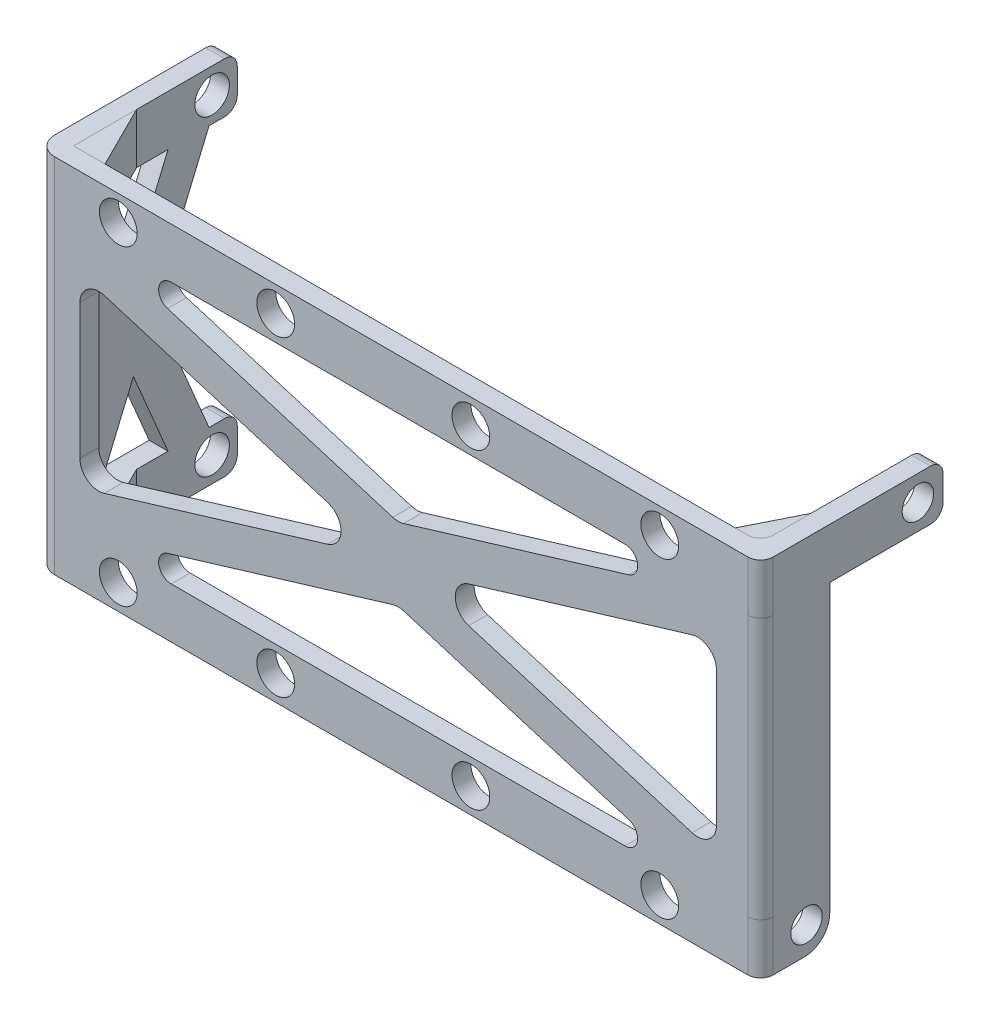
from build123d import *

# Parameters (mm, degrees)
SKETCH1_R             = 2.75
BOSS_EXTRUDE1_DEPTH   = 3
BOSS_EXTRUDE1_2_DEPTH = 3
SKETCH2_W             = 3
SKETCH2_H             = 8
BOSS_EXTRUDE3_DEPTH   = 112.1
SKETCH2_3_W           = 3
SKETCH2_3_H           = 8
BOSS_EXTRUDE4_DEPTH   = 112.1
SKETCH3_W             = 3
SKETCH3_H             = 8
BOSS_EXTRUDE5_DEPTH   = 26
SKETCH3_3_W           = 3
SKETCH3_3_H           = 8
BOSS_EXTRUDE6_DEPTH   = 8
FILLET1_R             = 2
FILLET2_R             = 2
FILLET4_R             = 2
SKETCH6_R             = 2.5
CUT_EXTRUDE1_DEPTH    = 3
SKETCH5_R             = 2.5
CUT_EXTRUDE2_DEPTH    = 3
BOSS_EXTRUDE7_DEPTH   = 3
FILLET6_R             = 4
FILLET7_R             = 3
FILLET8_START         = -30
FILLET8_DEPTH         = 60
GUSSET5_THICKNESS     = 8
GUSSET6_THICKNESS     = 8
FILLET14_R            = 2
BOSS_EXTRUDE15_REACH  = 129.762
SKETCH20_W            = 3
SKETCH20_H            = 8
GUSSET7_THICKNESS     = 10
FILLET15_R            = 2
FILLET16_R            = 2
FILLET18_R            = 2
GUSSET8_START         = -20
GUSSET8_DEPTH         = 10
FILLET19_R            = 2
SKETCH10_R            = 3
CUT_EXTRUDE3_DEPTH    = 3
BOSS_EXTRUDE16_DEPTH  = 3


with BuildPart() as part:
    # Sketch1 → Boss-Extrude1 (new body)
    with BuildSketch(Plane(origin=(0, 0, 0), x_dir=(0, 0, -1), z_dir=(1, 0, 0))):
        with BuildLine():
            Line((-25, 28.748737342), (2, 28.748737342))
            ThreePointArc((2, 28.748737342), (3.414213562, 28.162950904), (4, 26.748737342))
            Line((4, 26.748737342), (4, 22.748737342))
            ThreePointArc((4, 22.748737342), (3.414213562, 21.334523779), (2, 20.748737342))
            Line((2, 20.748737342), (-25, 20.748737342))
            Line((-25, 20.748737342), (-25, 28.748737342))
        make_face()
        with Locations((0, 24.748737342)):
            Circle(SKETCH1_R, mode=Mode.SUBTRACT)
    extrude(amount=BOSS_EXTRUDE1_DEPTH)

    # Sketch2 → Boss-Extrude3 (add)
    with BuildSketch(Plane(origin=(3, 0, 0), x_dir=(0, 0, -1), z_dir=(1, 0, 0))):
        with Locations((-23.5, 24.748737342)):
            Rectangle(SKETCH2_W, SKETCH2_H)
    extrude(amount=BOSS_EXTRUDE3_DEPTH)

    # Sketch3 → Boss-Extrude5 (add)
    with BuildSketch(Plane(origin=(0, 0, 22), x_dir=(-1, 0, 0), z_dir=(0, 0, -1))):
        with Locations((-113.6, 24.748737342)):
            Rectangle(SKETCH3_W, SKETCH3_H)
    extrude(amount=BOSS_EXTRUDE5_DEPTH)

    # Fillet1
    fillet1_edges = [part.edges().sort_by_distance(p)[0] for p in [
        (115.1, 24.748737342, 25),
        (0, 24.748737342, 25),
    ]]
    fillet(fillet1_edges, radius=FILLET1_R)

    # Fillet4
    fillet4_edges = [part.edges().sort_by_distance(p)[0] for p in [
        (113.6, 28.748737342, -4),
        (113.6, 20.748737342, -4),
    ]]
    fillet(fillet4_edges, radius=FILLET4_R)

    # Sketch5 → Cut-Extrude2 (cut)
    with BuildSketch(Plane(origin=(115.1, 0, 0), x_dir=(0, 0, -1), z_dir=(1, 0, 0))):
        with Locations((0, 24.748737342)):
            Circle(SKETCH5_R)
    extrude(amount=-CUT_EXTRUDE2_DEPTH, mode=Mode.SUBTRACT)



with BuildPart() as body_2:
    # Sketch1 → Boss-Extrude1 2 (new body)
    with BuildSketch(Plane(origin=(0, 0, 0), x_dir=(0, 0, -1), z_dir=(1, 0, 0))):
        with BuildLine():
            Line((-25, -20.748737342), (2, -20.748737342))
            ThreePointArc((2, -20.748737342), (3.414213562, -21.334523779), (4, -22.748737342))
            Line((4, -22.748737342), (4, -26.748737342))
            ThreePointArc((4, -26.748737342), (3.414213562, -28.162950904), (2, -28.748737342))
            Line((2, -28.748737342), (-25, -28.748737342))
            Line((-25, -28.748737342), (-25, -20.748737342))
        make_face()
        with Locations((0, -24.748737342)):
            Circle(SKETCH1_R, mode=Mode.SUBTRACT)
    extrude(amount=BOSS_EXTRUDE1_2_DEPTH)

    # Sketch2<3> → Boss-Extrude4 (add)
    with BuildSketch(Plane(origin=(3, 0, 0), x_dir=(0, 0, -1), z_dir=(1, 0, 0))):
        with Locations((-23.5, -24.748737342)):
            Rectangle(SKETCH2_3_W, SKETCH2_3_H)
    extrude(amount=BOSS_EXTRUDE4_DEPTH)

    # Sketch3<3> → Boss-Extrude6 (add)
    with BuildSketch(Plane(origin=(0, 0, 22), x_dir=(-1, 0, 0), z_dir=(0, 0, -1))):
        with Locations((-113.6, -24.748737342)):
            Rectangle(SKETCH3_3_W, SKETCH3_3_H)
    extrude(amount=BOSS_EXTRUDE6_DEPTH)

    # Fillet2
    fillet2_edges = [body_2.edges().sort_by_distance(p)[0] for p in [
        (115.1, -24.748737342, 25),
        (0, -24.748737342, 25),
    ]]
    fillet(fillet2_edges, radius=FILLET2_R)

    # Sketch6 → Cut-Extrude1 (cut)
    with BuildSketch(Plane(origin=(115.1, 0, 0), x_dir=(0, 0, -1), z_dir=(1, 0, 0))):
        with Locations((-17.69, -24.498737342)):
            Circle(SKETCH6_R)
    extrude(amount=-CUT_EXTRUDE1_DEPTH, mode=Mode.SUBTRACT)


with BuildPart() as part_1:
    add(part.part)

    add(body_2.part)  # Boss-Extrude7 merges body 2
    # Sketch7 → Boss-Extrude7 (add)
    with BuildSketch(Plane.XY.offset(25)):
        Polygon((0, -20.748737342), (0, 20.748737342), (8, 20.748737342), (57.55, 5.748737342), (107.1, 20.748737342), (115.1, 20.748737342), (115.1, -20.748737342), (107.1, -20.748737342), (57.55, -5.748737342), (8, -20.748737342), align=None)
        with BuildLine():
            Line((7, 10.739937144), (7, -10.739937144))
            ThreePointArc((7, -10.739937144), (8.212215616, -13.149050465), (10.869217997, -13.611253928))
            Line((10.869217997, -13.611253928), (46.346810362, -2.871316784))
            ThreePointArc((46.346810362, -2.871316784), (48.477592365, 0), (46.346810362, 2.871316784))
            Line((46.346810362, 2.871316784), (10.869217997, 13.611253928))
            ThreePointArc((10.869217997, 13.611253928), (8.212215616, 13.149050465), (7, 10.739937144))
        make_face(mode=Mode.SUBTRACT)
        with BuildLine():
            Line((104.230782003, -13.611253928), (68.753189638, -2.871316784))
            ThreePointArc((68.753189638, -2.871316784), (66.622407635, 0), (68.753189638, 2.871316784))
            Line((68.753189638, 2.871316784), (104.230782003, 13.611253928))
            ThreePointArc((104.230782003, 13.611253928), (106.887784384, 13.149050465), (108.1, 10.739937144))
            Line((108.1, 10.739937144), (108.1, -10.739937144))
            ThreePointArc((108.1, -10.739937144), (106.887784384, -13.149050465), (104.230782003, -13.611253928))
        make_face(mode=Mode.SUBTRACT)
    extrude(amount=-BOSS_EXTRUDE7_DEPTH)

    # Fillet6
    fillet6_edges = [part_1.edges().sort_by_distance(p)[0] for p in [
        (113.6, -28.748737342, 14),
    ]]
    fillet(fillet6_edges, radius=FILLET6_R)

    # Fillet7
    fillet7_edges = [part_1.edges().sort_by_distance(p)[0] for p in [
        (57.55, -5.748737342, 23.5),
        (57.55, 5.748737342, 23.5),
    ]]
    fillet(fillet7_edges, radius=FILLET7_R)

    # Fillet8: read off the stored shape, not the designer's step
    # Fillet8 outline → Fillet8 (cut)
    with BuildSketch(Plane(origin=(0, 0, 0), x_dir=(1, 0, 0), z_dir=(0, 1, 0)).offset(FILLET8_START)):
        with BuildLine():
            ThreePointArc((3, -25), (0.878679656, -24.121320344), (0, -22))
            Line((0, -22), (0, -25))
            Line((0, -25), (3, -25))
        make_face()
    extrude(amount=FILLET8_DEPTH, mode=Mode.SUBTRACT)

    # Fillet14
    fillet14_edges = [part_1.edges().sort_by_distance(p)[0] for p in [
        (115.1, 0, 25),
    ]]
    fillet(fillet14_edges, radius=FILLET14_R)

    # Sketch20 → Boss-Extrude15 (add, up to next)
    with BuildSketch(Plane(origin=(0, -20.748737342, 0), x_dir=(1, 0, 0), z_dir=(0, 1, 0)), mode=Mode.PRIVATE) as boss_extrude15_sk1:
        with Locations((113.6, -18)):
            Rectangle(SKETCH20_W, SKETCH20_H)
    boss_extrude15_tool1 = extrude(boss_extrude15_sk1.sketch, amount=BOSS_EXTRUDE15_REACH, mode=Mode.PRIVATE) - part_1.part
    add(boss_extrude15_tool1.solids().sort_by_distance((113.6, -20.748737, 18))[0])

    # Fillet15
    fillet15_edges = [part_1.edges().sort_by_distance(p)[0] for p in [
        (112.1, 0, 22),
    ]]
    fillet(fillet15_edges, radius=FILLET15_R)

    # Fillet18
    fillet18_edges = [part_1.edges().sort_by_distance(p)[0] for p in [
        (8, -20.748737342, 23.5),
        (8, 20.748737342, 23.5),
        (107.1, 20.748737342, 23.5),
        (107.1, -20.748737342, 23.5),
    ]]
    fillet(fillet18_edges, radius=FILLET18_R)

    # Sketch10 → Cut-Extrude3 (cut)
    with BuildSketch(Plane.XY.offset(25)):
        with Locations((38.1, 24.748737342)):
            Circle(SKETCH10_R)
        with Locations((69.1, 24.748737342)):
            Circle(SKETCH10_R)
        with Locations(Location((69.1, -24.748737342, 0), (0, 0, 180))):
            Circle(SKETCH10_R)
        with Locations(Location((38.1, -24.748737342, 0), (0, 0, 180))):
            Circle(SKETCH10_R)
        with Locations((13.1, 24.748737342)):
            Circle(SKETCH10_R)
        with Locations((13.1, -24.748737342)):
            Circle(SKETCH10_R)
        with Locations((99.1, 24.748737342)):
            Circle(SKETCH10_R)
        with Locations((99.1, -24.748737342)):
            Circle(SKETCH10_R)
    extrude(amount=-CUT_EXTRUDE3_DEPTH, mode=Mode.SUBTRACT)


with BuildPart() as body_2_2:
    # Gusset5: a gusset: a plate 8.0 thick in the corner of two members, its outline drawn in place
    gusset5_outline = Wire([Line((3, 20.748737342, 22), (3, 20.748737342, 12)), Line((3, 20.748737342, 12), (8, 20.748737342, 22)), Line((8, 20.748737342, 22), (3, 20.748737342, 22))])
    add(extrude(Face(gusset5_outline), amount=GUSSET5_THICKNESS, dir=(0, 1, 0)))


with BuildPart() as body_3:
    # Gusset6: a gusset: a plate 8.0 thick in the corner of two members, its outline drawn in place
    gusset6_outline = Wire([Line((3, -20.748737342, 22), (8, -20.748737342, 22)), Line((8, -20.748737342, 22), (3, -20.748737342, 12)), Line((3, -20.748737342, 12), (3, -20.748737342, 22))])
    add(extrude(Face(gusset6_outline), amount=GUSSET6_THICKNESS, dir=(0, -1, 0)))


    add(part_1.part)  # Boss-Extrude16 merges part
    # Sketch13 → Boss-Extrude16 (add)
    with BuildSketch(Plane.ZY):
        Polygon((7, 20.748737342), (12.5, 7.715909239), (18, 20.748737342), (22, 20.748737342), (22, 14.251262658), (22, -14.251262658), (22, -20.748737342), (18, -20.748737342), (12.5, -7.715909239), (7, -20.748737342), (0.487599088, -20.748737342), (9.243799544, 0), (0.487599088, 20.748737342), align=None)
    extrude(amount=-BOSS_EXTRUDE16_DEPTH)


with BuildPart() as body_4:
    # Gusset7: a gusset: a plate 10.0 thick in the corner of two members, its outline drawn in place
    gusset7_outline = Wire([Line((112.1, 18.748737342, 22), (108.1, 18.748737342, 22)), Line((108.1, 18.748737342, 22), (112.1, 18.748737342, 14)), Line((112.1, 18.748737342, 14), (112.1, 18.748737342, 22))])
    add(extrude(Face(gusset7_outline), amount=GUSSET7_THICKNESS, dir=(0, 1, 0)))

    # Fillet16
    fillet16_edges = [body_4.edges().sort_by_distance(p)[0] for p in [
        (112.1, 23.748737342, 22),
    ]]
    fillet(fillet16_edges, radius=FILLET16_R)


with BuildPart() as body_5:
    # Gusset8: read off the stored shape, not the designer's step
    # Gusset8 outline → Gusset8 (new body)
    with BuildSketch(Plane(origin=(0, 0, 0), x_dir=(1, 0, 0), z_dir=(0, 1, 0)).offset(GUSSET8_START)):
        Polygon((112.1, -14), (108.1, -22), (112.1, -22), align=None)
    extrude(amount=GUSSET8_DEPTH)

    # Fillet19
    fillet19_edges = [body_5.edges().sort_by_distance(p)[0] for p in [
        (112.1, -15, 22),
    ]]
    fillet(fillet19_edges, radius=FILLET19_R)


solid = Compound([body_2_2.part, body_3.part, body_4.part, body_5.part])
